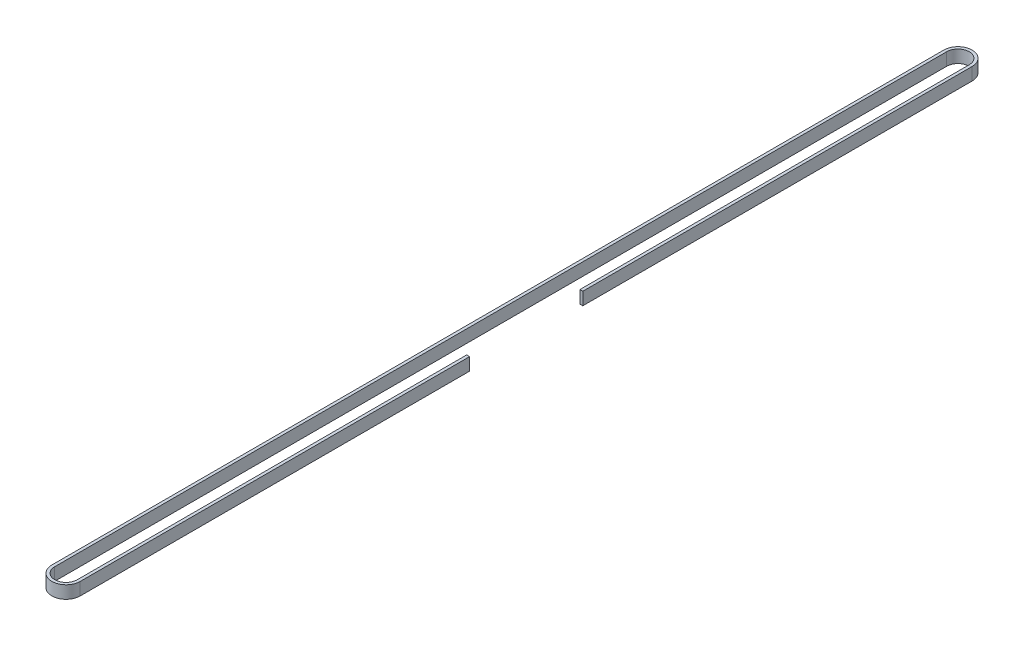
from build123d import *

# Parameters (mm, degrees)
EXTRUDE_THIN1_DEPTH = 6


with BuildPart() as part:
    # Sketch1 → Extrude-Thin1 (new body)
    with BuildSketch(Plane(origin=(0, 0, 0), x_dir=(1, 0, 0), z_dir=(0, 1, 0))):
        with BuildLine():
            Line((355.746, -109.767481844), (355.746, -294.767481844))
            ThreePointArc((355.746, -294.767481844), (350.38, -300.133481844), (345.014, -294.767481844))
            Line((345.014, -294.767481844), (345.014, 128.982518156))
            ThreePointArc((345.014, 128.982518156), (350.38, 134.348518156), (355.746, 128.982518156))
            Line((355.746, 128.982518156), (355.746, -56.017481844))
            Line((355.746, -56.017481844), (357.126, -56.017481844))
            Line((357.126, -56.017481844), (357.126, 128.982518156))
            ThreePointArc((357.126, 128.982518156), (350.38, 135.728518156), (343.634, 128.982518156))
            Line((343.634, 128.982518156), (343.634, -294.767481844))
            ThreePointArc((343.634, -294.767481844), (350.38, -301.513481844), (357.126, -294.767481844))
            Line((357.126, -294.767481844), (357.126, -109.767481844))
            Line((357.126, -109.767481844), (355.746, -109.767481844))
        make_face()
    extrude(amount=EXTRUDE_THIN1_DEPTH)


solid = part.part
